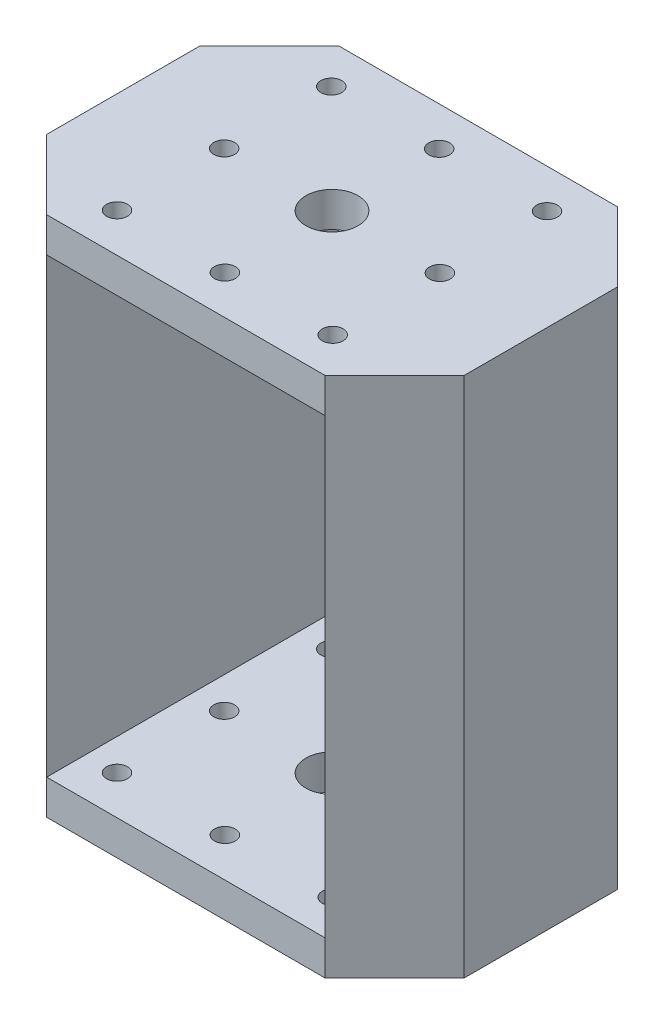
from build123d import *

# Parameters (mm, degrees)
SKETCH3_W           = 60
SKETCH3_H           = 42
SKETCH3_R           = 3.75
SKETCH3_R_2         = 1.5
BOSS_EXTRUDE1_DEPTH = 75
SKETCH4_W           = 60
SKETCH4_H           = 65
CUT_EXTRUDE1_DEPTH  = 105.828431258
BOSS_EXTRUDE2_REACH = 103.311
SKETCH5_W           = 10
SKETCH5_H           = 42
CHAMFER2_SIZE       = 10


with BuildPart() as part:
    # Sketch3 → Boss-Extrude1 (new body)
    with BuildSketch(Plane(origin=(0, 0, 0), x_dir=(1, 0, 0), z_dir=(0, 1, 0))):
        with Locations((30, 21)):
            Rectangle(SKETCH3_W, SKETCH3_H)
        with Locations(Location((30, 21, 0), (0, 0, 270))):
            Circle(SKETCH3_R, mode=Mode.SUBTRACT)
        with Locations(Location((14.5, 36.4, 0), (0, 0, 270))):
            Circle(SKETCH3_R_2, mode=Mode.SUBTRACT)
        with Locations(Location((45.5, 36.4, 0), (0, 0, 270))):
            Circle(SKETCH3_R_2, mode=Mode.SUBTRACT)
        with Locations(Location((45.5, 5.6, 0), (0, 0, 270))):
            Circle(SKETCH3_R_2, mode=Mode.SUBTRACT)
        with Locations(Location((14.5, 5.6, 0), (0, 0, 270))):
            Circle(SKETCH3_R_2, mode=Mode.SUBTRACT)
        with Locations(Location((30, 36.4, 0), (0, 0, 270))):
            Circle(SKETCH3_R_2, mode=Mode.SUBTRACT)
        with Locations(Location((45.5, 21, 0), (0, 0, 270))):
            Circle(SKETCH3_R_2, mode=Mode.SUBTRACT)
        with Locations(Location((30, 5.6, 0), (0, 0, 270))):
            Circle(SKETCH3_R_2, mode=Mode.SUBTRACT)
        with Locations(Location((14.5, 21, 0), (0, 0, 270))):
            Circle(SKETCH3_R_2, mode=Mode.SUBTRACT)
    extrude(amount=BOSS_EXTRUDE1_DEPTH)

    # Sketch4 → Cut-Extrude1 (cut, through all)
    with BuildSketch(Plane(origin=(0, 0, -42), x_dir=(-1, 0, 0), z_dir=(0, 0, -1))):
        with Locations((-30, 37.5)):
            Rectangle(SKETCH4_W, SKETCH4_H)
    extrude(amount=-CUT_EXTRUDE1_DEPTH, mode=Mode.SUBTRACT)


with BuildPart() as cut_extrude1_piece_1:
    # of the separate pieces the step leaves, piece 1, a body of its own (cut_extrude1_pieces)
    add(part.part.solids().sort_by_distance((60, 70, 0))[0])

    # Sketch5 → Boss-Extrude2 (add, up to next)
    with BuildSketch(Plane(origin=(0, 5, 0), x_dir=(1, 0, 0), z_dir=(0, 1, 0)), mode=Mode.PRIVATE) as boss_extrude2_sk1:
        with Locations((5, 21)):
            Rectangle(SKETCH5_W, SKETCH5_H)
    boss_extrude2_tool1 = extrude(boss_extrude2_sk1.sketch, amount=BOSS_EXTRUDE2_REACH, mode=Mode.PRIVATE) - cut_extrude1_piece_1.part
    # Sketch5 → Boss-Extrude2 (add, up to next)
    with BuildSketch(Plane(origin=(0, 5, 0), x_dir=(1, 0, 0), z_dir=(0, 1, 0)), mode=Mode.PRIVATE) as boss_extrude2_sk2:
        with Locations((55, 21)):
            Rectangle(SKETCH5_W, SKETCH5_H)
    boss_extrude2_tool2 = extrude(boss_extrude2_sk2.sketch, amount=BOSS_EXTRUDE2_REACH, mode=Mode.PRIVATE) - cut_extrude1_piece_1.part


with BuildPart() as cut_extrude1_piece_2:
    # of the separate pieces the step leaves, piece 2, a body of its own (cut_extrude1_pieces)
    add(part.part.solids().sort_by_distance((0, 0, 0))[0])


with BuildPart() as cut_extrude1_piece_1_1:
    add(cut_extrude1_piece_1.part)

    add(cut_extrude1_piece_2.part)  # Boss-Extrude2 merges Cut-Extrude1 piece 2
    add(boss_extrude2_tool1.solids().sort_by_distance((5, 5, -21))[0])
    add(boss_extrude2_tool2.solids().sort_by_distance((55, 5, -21))[0])

    # Chamfer2
    chamfer2_edges = [cut_extrude1_piece_1_1.edges().sort_by_distance(p)[0] for p in [
        (0, 37.5, -42),
        (0, 37.5, 0),
        (60, 37.5, 0),
        (60, 37.5, -42),
    ]]
    chamfer(chamfer2_edges, length=CHAMFER2_SIZE - 0.0001)  # a hair under: the kernel refuses the full size


solid = cut_extrude1_piece_1_1.part
